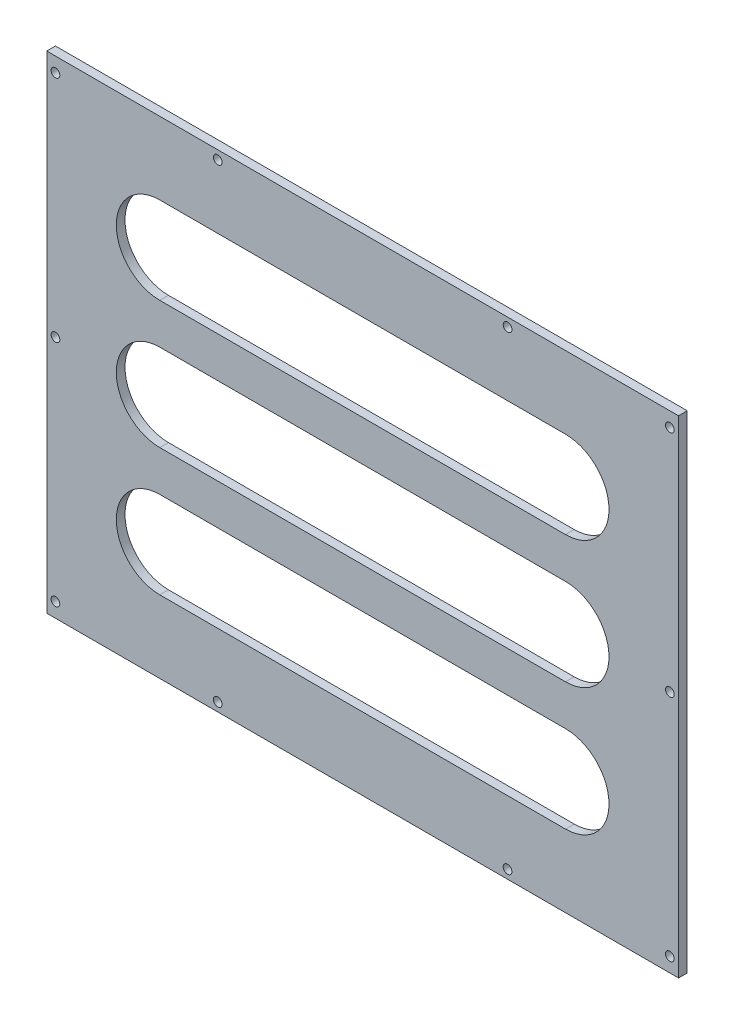
from build123d import *

# Parameters (mm, degrees)
SKETCH1_W           = 168
SKETCH1_H           = 218
SKETCH1_R           = 1.5
BOSS_EXTRUDE2_DEPTH = 3


with BuildPart() as part:
    # Sketch1 → Boss-Extrude2 (new body)
    with BuildSketch(Plane(origin=(0, 0, 0), x_dir=(0, 1, 0), z_dir=(0, 0, 1))):
        with Locations((84, 109)):
            Rectangle(SKETCH1_W, SKETCH1_H)
        with Locations((5, 3)):
            Circle(SKETCH1_R, mode=Mode.SUBTRACT)
        with Locations((5, 215)):
            Circle(SKETCH1_R, mode=Mode.SUBTRACT)
        with Locations((163, 215)):
            Circle(SKETCH1_R, mode=Mode.SUBTRACT)
        with Locations((163, 3)):
            Circle(SKETCH1_R, mode=Mode.SUBTRACT)
        with Locations((84, 215)):
            Circle(SKETCH1_R, mode=Mode.SUBTRACT)
        with Locations((84, 3)):
            Circle(SKETCH1_R, mode=Mode.SUBTRACT)
        with Locations((3, 59)):
            Circle(SKETCH1_R, mode=Mode.SUBTRACT)
        with Locations((165, 59)):
            Circle(SKETCH1_R, mode=Mode.SUBTRACT)
        with Locations((165, 159)):
            Circle(SKETCH1_R, mode=Mode.SUBTRACT)
        with Locations((3, 159)):
            Circle(SKETCH1_R, mode=Mode.SUBTRACT)
        with BuildLine():
            Line((55, 179), (55, 39))
            ThreePointArc((55, 39), (40, 24), (25, 39))
            Line((25, 39), (25, 179))
            ThreePointArc((25, 179), (40, 194), (55, 179))
        make_face(mode=Mode.SUBTRACT)
        with BuildLine():
            Line((99, 179), (99, 39))
            ThreePointArc((99, 39), (84, 24), (69, 39))
            Line((69, 39), (69, 179))
            ThreePointArc((69, 179), (84, 194), (99, 179))
        make_face(mode=Mode.SUBTRACT)
        with BuildLine():
            Line((143, 179), (143, 39))
            ThreePointArc((143, 39), (128, 24), (113, 39))
            Line((113, 39), (113, 179))
            ThreePointArc((113, 179), (128, 194), (143, 179))
        make_face(mode=Mode.SUBTRACT)
    extrude(amount=BOSS_EXTRUDE2_DEPTH)


solid = part.part
